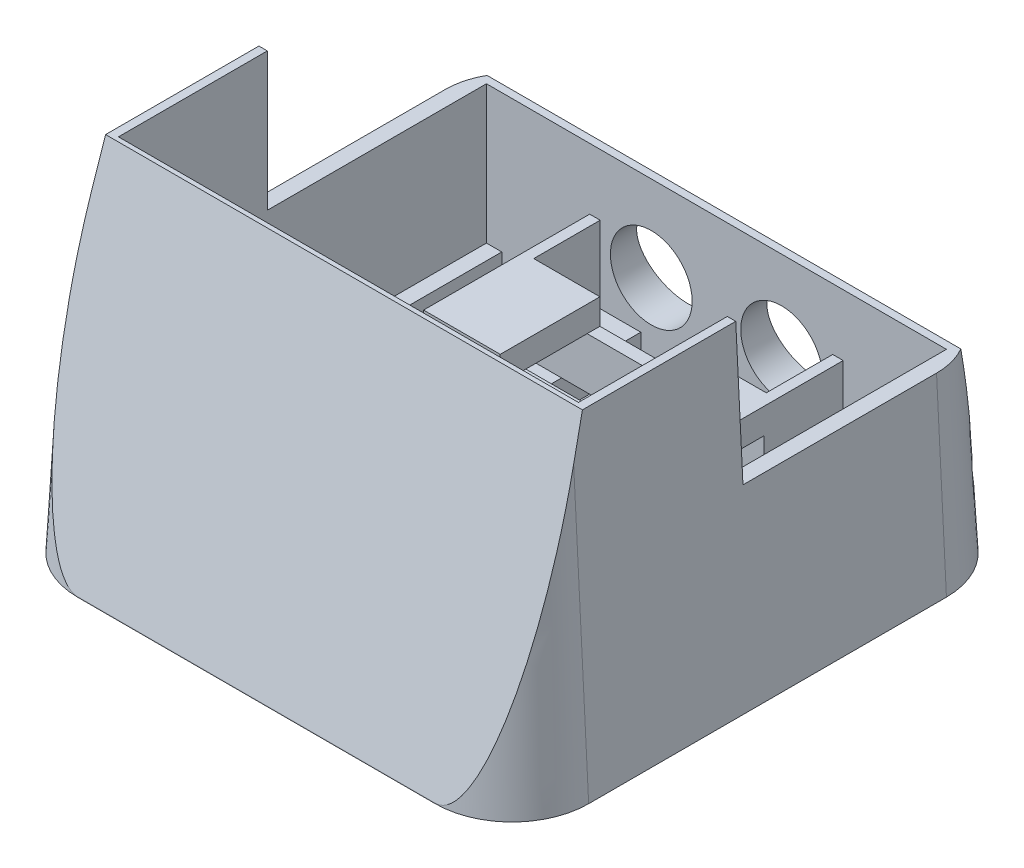
from build123d import *

# Parameters (mm, degrees)
BOSS_EXTRUDE1_DEPTH     = 10
SKETCH2_W               = 17.2
SKETCH2_H               = 43
CUT_EXTRUDE1_DEPTH      = 72.414284285
SKETCH3_W               = 90
SKETCH3_H               = 34
SKETCH3_W_2             = 80
SKETCH3_H_2             = 24
BOSS_EXTRUDE3_DEPTH     = 15
SKETCH4_W               = 49.6
SKETCH4_H               = 5
BOSS_EXTRUDE4_DEPTH     = 10
SKETCH5_W               = 15
SKETCH5_H               = 22
BOSS_EXTRUDE5_DEPTH     = 5
SKETCH6_W               = 90
SKETCH6_H               = 77
BOSS_EXTRUDE6_DEPTH     = 15
BOSS_EXTRUDE8_DEPTH     = 39
CHAMFER1_SIZE           = 64
CHAMFER1_SIZE_2         = 3.354097874
CHAMFER2_SIZE           = 64
CHAMFER2_SIZE_2         = 11.405813635
CHAMFER3_SIZE           = 64
CHAMFER3_SIZE_2         = 13.775745352
CUT_EXTRUDE3_DEPTH      = 95.500525601
CUT_EXTRUDE3_DEPTH_BACK = 95.500525601
SKETCH10_W              = 50
SKETCH10_H              = 27
SKETCH15_R              = 8
CUT_EXTRUDE5_DEPTH      = 122.227059686
CUT_EXTRUDE6_DEPTH      = 2.5
SKETCH18_W              = 29.6
SKETCH18_H              = 43
CUT_EXTRUDE7_DEPTH      = 10
CUT_EXTRUDE8_DEPTH      = 15
SKETCH21_W              = 29.6
SKETCH21_H              = 33
BOSS_EXTRUDE10_DEPTH    = 4.5
SKETCH23_W              = 2.05
SKETCH23_H              = 13
BOSS_EXTRUDE11_DEPTH    = 15


with BuildPart() as part:
    # Sketch1 → Boss-Extrude1 (new body)
    with BuildSketch(Plane(origin=(0, 0, 0), x_dir=(1, 0, 0), z_dir=(0, 1, 0))):
        with BuildLine():
            Line((-35, 50), (35, 50))
            ThreePointArc((35, 50), (45.606601718, 45.606601718), (50, 35))
            Line((50, 35), (50, -35))
            ThreePointArc((50, -35), (45.606601718, -45.606601718), (35, -50))
            Line((35, -50), (-35, -50))
            ThreePointArc((-35, -50), (-45.606601718, -45.606601718), (-50, -35))
            Line((-50, -35), (-50, 35))
            ThreePointArc((-50, 35), (-45.606601718, 45.606601718), (-35, 50))
        make_face()
    extrude(amount=BOSS_EXTRUDE1_DEPTH)

    # Sketch2 → Cut-Extrude1 (cut, through all)
    with BuildSketch(Plane(origin=(0, 10, 0), x_dir=(1, 0, 0), z_dir=(0, 1, 0))):
        with Locations((-33.4, 18.5)):
            Rectangle(SKETCH2_W, SKETCH2_H)
        with Locations((33.4, 18.5)):
            Rectangle(SKETCH2_W, SKETCH2_H)
    extrude(amount=-CUT_EXTRUDE1_DEPTH, mode=Mode.SUBTRACT)

    # Sketch3 → Boss-Extrude3 (add)
    with BuildSketch(Plane(origin=(0, 10, 0), x_dir=(1, 0, 0), z_dir=(0, 1, 0))):
        with Locations((0, -20)):
            Rectangle(SKETCH3_W, SKETCH3_H)
        with Locations((0, -20)):
            Rectangle(SKETCH3_W_2, SKETCH3_H_2, mode=Mode.SUBTRACT)
    extrude(amount=BOSS_EXTRUDE3_DEPTH)

    # Sketch4 → Boss-Extrude4 (add)
    with BuildSketch(Plane(origin=(0, 10, 0), x_dir=(1, 0, 0), z_dir=(0, 1, 0))):
        with Locations((0, 10)):
            Rectangle(SKETCH4_W, SKETCH4_H)
        with Locations((0, 27)):
            Rectangle(SKETCH4_W, SKETCH4_H)
    extrude(amount=BOSS_EXTRUDE4_DEPTH)

    # Sketch5 → Boss-Extrude5 (add)
    with BuildSketch(Plane(origin=(0, 20, 0), x_dir=(1, 0, 0), z_dir=(0, 1, 0))):
        with Locations((-17.3, 18.5)):
            Rectangle(SKETCH5_W, SKETCH5_H)
        with Locations((17.3, 18.5)):
            Rectangle(SKETCH5_W, SKETCH5_H)
    extrude(amount=BOSS_EXTRUDE5_DEPTH)

    # Sketch6 → Boss-Extrude6 (add)
    with BuildSketch(Plane(origin=(0, 10, 0), x_dir=(1, 0, 0), z_dir=(0, 1, 0))):
        with BuildLine():
            Line((-50, 35), (-50, -35))
            ThreePointArc((-50, -35), (-45.606601718, -45.606601718), (-35, -50))
            Line((-35, -50), (35, -50))
            ThreePointArc((35, -50), (45.606601718, -45.606601718), (50, -35))
            Line((50, -35), (50, 35))
            ThreePointArc((50, 35), (45.606601718, 45.606601718), (35, 50))
            Line((35, 50), (-35, 50))
            ThreePointArc((-35, 50), (-45.606601718, 45.606601718), (-50, 35))
        make_face()
        with Locations((0, 1.5)):
            Rectangle(SKETCH6_W, SKETCH6_H, mode=Mode.SUBTRACT)
    extrude(amount=BOSS_EXTRUDE6_DEPTH)

    # Sketch9 → Boss-Extrude8 (add)
    with BuildSketch(Plane(origin=(0, 25, 0), x_dir=(1, 0, 0), z_dir=(0, 1, 0))):
        with BuildLine():
            Line((-50, 35), (-50, -35))
            ThreePointArc((-50, -35), (-45.606601718, -45.606601718), (-35, -50))
            Line((-35, -50), (35, -50))
            ThreePointArc((35, -50), (45.606601718, -45.606601718), (50, -35))
            Line((50, -35), (50, 35))
            ThreePointArc((50, 35), (45.606601718, 45.606601718), (35, 50))
            Line((35, 50), (-35, 50))
            ThreePointArc((-35, 50), (-45.606601718, 45.606601718), (-50, 35))
        make_face()
        with BuildLine():
            Line((-45, 35), (-45, -32))
            Line((-45, -32), (45, -32))
            Line((45, -32), (45, 35))
            ThreePointArc((45, 35), (44.659258263, 37.588190451), (43.660254038, 40))
            Line((43.660254038, 40), (-43.660254038, 40))
            ThreePointArc((-43.660254038, 40), (-44.659258263, 37.588190451), (-45, 35))
        make_face(mode=Mode.SUBTRACT)
    extrude(amount=BOSS_EXTRUDE8_DEPTH)

    # Chamfer1
    # the kernel refuses this chamfer: 64, 3.354097874 mm, written as the material it takes off along each edge
    with BuildSketch(Plane(origin=(-35, 64, 50), x_dir=(0, -0.9999979738662979, 0.002013023422382214), z_dir=(1, 0, 0)), Plane(origin=(50, 64, 35), x_dir=(0.002013023422382214, -0.9999979738662979, 0), z_dir=(0, 0, -1)), Plane(origin=(-50, 64, -35), x_dir=(-0.002013023422382214, -0.9999979738662979, 0), z_dir=(0, 0, 1)), Plane(origin=(35, 64, -50), x_dir=(0, -0.9999979738662979, -0.002013023422382214), z_dir=(-1, 0, 0))) as chamfer1_piece_1:
        Polygon((CHAMFER1_SIZE * 0.999997973866, CHAMFER1_SIZE * 0.00201302342238), (-CHAMFER1_SIZE_2 * 0.00201302342245, CHAMFER1_SIZE_2 * 0.9999979739), (0, 0), align=None)
    extrude(amount=70, mode=Mode.SUBTRACT)
    with BuildSketch(Plane(origin=(35, 64, 35), x_dir=(0, 0, 1), z_dir=(-1, 0, 0))) as chamfer1_piece_2:
        Polygon((15, -CHAMFER1_SIZE), (15 - CHAMFER1_SIZE_2, 0), (15, 0), align=None)
    revolve(axis=Axis((35, 64, 35), (0, 1, 0)), revolution_arc=90, mode=Mode.SUBTRACT)
    with BuildSketch(Plane(origin=(-35, 64, 35), x_dir=(-1, 0, 0), z_dir=(0, 0, -1))) as chamfer1_piece_3:
        Polygon((15, -CHAMFER1_SIZE), (15 - CHAMFER1_SIZE_2, 0), (15, 0), align=None)
    revolve(axis=Axis((-35, 64, 35), (0, 1, 0)), revolution_arc=90, mode=Mode.SUBTRACT)
    with BuildSketch(Plane(origin=(35, 64, -35), x_dir=(1, 0, 0), z_dir=(0, 0, 1))) as chamfer1_piece_4:
        Polygon((15, -CHAMFER1_SIZE), (15 - CHAMFER1_SIZE_2, 0), (15, 0), align=None)
    revolve(axis=Axis((35, 64, -35), (0, 1, 0)), revolution_arc=90, mode=Mode.SUBTRACT)
    with BuildSketch(Plane(origin=(-35, 64, -35), x_dir=(0, 0, -1), z_dir=(1, 0, 0))) as chamfer1_piece_5:
        Polygon((15 - CHAMFER1_SIZE_2, 0), (15, -CHAMFER1_SIZE), (15, 0), align=None)
    revolve(axis=Axis((-35, 64, -35), (0, 1, 0)), revolution_arc=90, mode=Mode.SUBTRACT)

    # Chamfer2
    # the kernel refuses this chamfer: 64, 11.405813635 mm, written as the material it takes off along each edge
    with BuildSketch(Plane(origin=(201.306482971, 64, -46.645902126), x_dir=(0, -0.9982575003065525, -0.05900816114499234), z_dir=(-1, 0, 0))) as chamfer2_piece_1:
        Polygon((CHAMFER2_SIZE * 0.999977671636, CHAMFER2_SIZE * 0.0066825316561), (-CHAMFER2_SIZE_2 * 0.0590081611462, CHAMFER2_SIZE_2 * 0.998257500326), (0, 0), align=None)
    extrude(amount=402.612965942, mode=Mode.SUBTRACT)

    # Chamfer3
    # the kernel refuses this chamfer: 64, 13.775745352 mm, written as the material it takes off along each edge
    with BuildSketch(Plane(origin=(-201.265469314, 64, 46.645902126), x_dir=(0, -0.9981787050157903, 0.06032638604292662), z_dir=(1, 0, 0))) as chamfer3_piece_1:
        Polygon((CHAMFER3_SIZE * 0.999967974892, CHAMFER3_SIZE * 0.00800307379952), (-CHAMFER3_SIZE_2 * 0.060326386045, CHAMFER3_SIZE_2 * 0.99817870505), (0, 0), align=None)
    extrude(amount=402.530938629, mode=Mode.SUBTRACT)

    # Sketch10 → Cut-Extrude3 (cut, two sides: drawn at the far end of the back side and taken through both)
    with BuildSketch(Plane(origin=(0, 1.307501734, 0), x_dir=(0, 0, 1), z_dir=(-1, 0, 0)).offset(-CUT_EXTRUDE3_DEPTH_BACK)):
        with Locations((-22.129843227, 49.192498266)):
            Rectangle(SKETCH10_W, SKETCH10_H)
    extrude(amount=CUT_EXTRUDE3_DEPTH + CUT_EXTRUDE3_DEPTH_BACK, mode=Mode.SUBTRACT)

    # Sketch15 → Cut-Extrude5 (cut, through all)
    with BuildSketch(Plane.XY.offset(-40)):
        with Locations((-12.75, 20.25)):
            Circle(SKETCH15_R)
        with Locations((12.75, 20.25)):
            Circle(SKETCH15_R)
    extrude(amount=-CUT_EXTRUDE5_DEPTH, mode=Mode.SUBTRACT)

    # Sketch17 → Cut-Extrude6 (cut)
    with BuildSketch(Plane(origin=(0, 0, -29.5), x_dir=(-1, 0, 0), z_dir=(0, 0, -1))):
        Polygon((-24.8, 10), (24.8, 10), (24.8, 25), (9.8, 25), (9.8, 20), (-9.8, 20), (-9.8, 25), (-24.8, 25), align=None)
    extrude(amount=-CUT_EXTRUDE6_DEPTH, mode=Mode.SUBTRACT)

    # Sketch18 → Cut-Extrude7 (cut)
    with BuildSketch(Plane.XZ):
        with Locations((0, -18.5)):
            Rectangle(SKETCH18_W, SKETCH18_H)
    extrude(amount=-CUT_EXTRUDE7_DEPTH, mode=Mode.SUBTRACT)

    # Sketch20 → Cut-Extrude8 (cut)
    with BuildSketch(Plane.XZ.offset(-25)):
        with BuildLine():
            Line((-45, -35), (-45, -40))
            Line((-45, -40), (-43.660254038, -40))
            ThreePointArc((-43.660254038, -40), (-44.659258263, -37.588190451), (-45, -35))
        make_face()
        with BuildLine():
            Line((45, -40), (45, -35))
            ThreePointArc((45, -35), (44.659258263, -37.588190451), (43.660254038, -40))
            Line((43.660254038, -40), (45, -40))
        make_face()
    extrude(amount=-CUT_EXTRUDE8_DEPTH, mode=Mode.SUBTRACT)

    # Sketch21 → Boss-Extrude10 (add)
    with BuildSketch(Plane.XZ):
        with Locations((0, -13.5)):
            Rectangle(SKETCH21_W, SKETCH21_H)
    extrude(amount=-BOSS_EXTRUDE10_DEPTH)

    # Sketch23 → Boss-Extrude11 (add)
    with BuildSketch(Plane(origin=(0, 10, 0), x_dir=(1, 0, 0), z_dir=(0, 1, 0))):
        with Locations((-23.775, 33.5)):
            Rectangle(SKETCH23_W, SKETCH23_H)
        with Locations((23.775, 33.5)):
            Rectangle(SKETCH23_W, SKETCH23_H)
    extrude(amount=BOSS_EXTRUDE11_DEPTH)


solid = part.part
